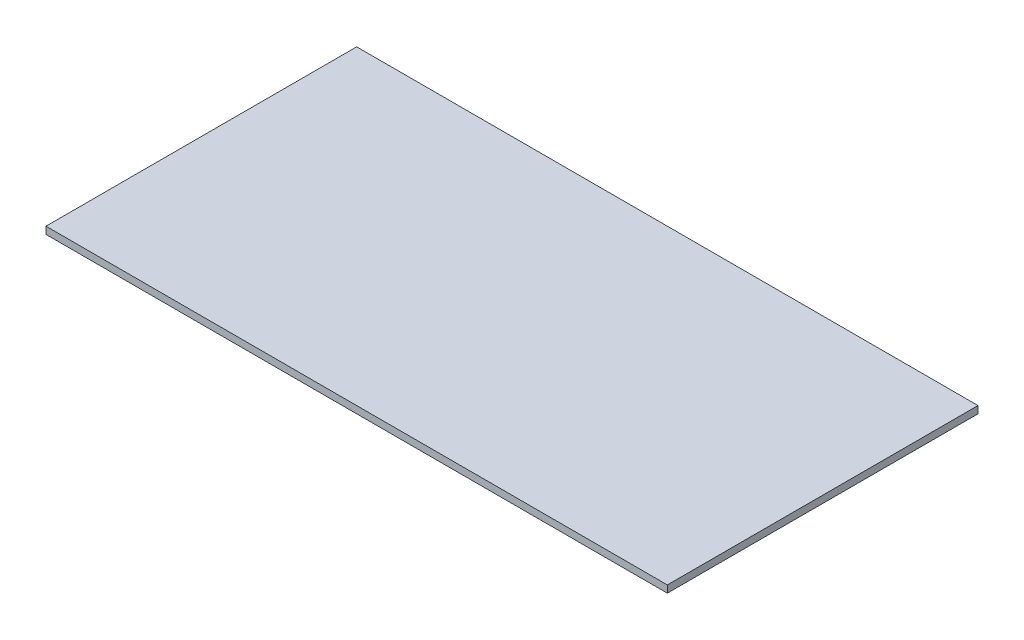
from build123d import *

# Parameters (mm, degrees)
SKETCH1_W           = 260
SKETCH1_H           = 130
BOSS_EXTRUDE1_DEPTH = 3


with BuildPart() as part:
    # Sketch1 → Boss-Extrude1 (new body)
    with BuildSketch(Plane(origin=(0, 0, 0), x_dir=(1, 0, 0), z_dir=(0, 1, 0))):
        with Locations((-130, -19.410958904)):
            Rectangle(SKETCH1_W, SKETCH1_H)
    extrude(amount=BOSS_EXTRUDE1_DEPTH)


solid = part.part
